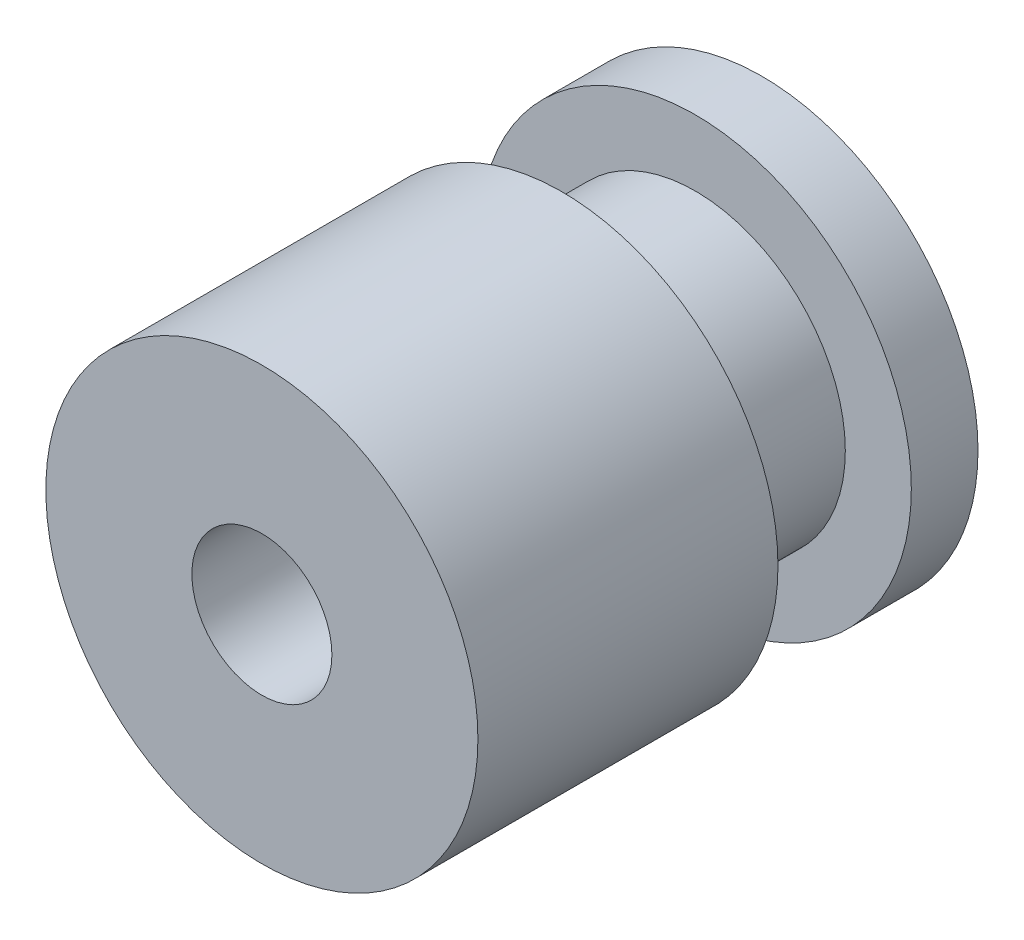
from build123d import *

# Parameters (mm, degrees)
SKETCH1_R               = 6.48
BOSS_EXTRUDE1_DEPTH     = 15
CUT_EXTRUDE3_DEPTH      = 2
CUT_EXTRUDE3_DEPTH_BACK = 2
CUT_EXTRUDE3_START      = -11
SKETCH8_OUTSIDE_W       = 19.696
SKETCH8_OUTSIDE_H       = 19.696
SKETCH8_OUTSIDE_R       = 4.5
M5_TAPPED_HOLE1_D       = 4.2
M5_TAPPED_HOLE1_DEPTH   = 7.4
M5_TAPPED_HOLE1_TIP     = 1.2618073


# Read off the part's stored shape, not the designer's step: Split2
with BuildPart() as part:
    # Sketch1 → Boss-Extrude1 (new body)
    with BuildSketch(Plane.XY):
        Circle(SKETCH1_R)
    extrude(amount=BOSS_EXTRUDE1_DEPTH)

    # Sketch8 outside → Cut-Extrude3 (cut, two sides: drawn at the far end of the back side and taken through both)
    with BuildSketch(Plane.XY.offset(15).offset(CUT_EXTRUDE3_START - CUT_EXTRUDE3_DEPTH_BACK)):
        Rectangle(SKETCH8_OUTSIDE_W, SKETCH8_OUTSIDE_H)
        Circle(SKETCH8_OUTSIDE_R, mode=Mode.SUBTRACT)
    extrude(amount=CUT_EXTRUDE3_DEPTH + CUT_EXTRUDE3_DEPTH_BACK, mode=Mode.SUBTRACT)

    # M5 Tapped Hole1
    with Locations(Plane.XY.offset(15)):
        with Locations((0, 0)):
            Hole(M5_TAPPED_HOLE1_D / 2, depth=M5_TAPPED_HOLE1_DEPTH)
            with Locations((0, 0, -(M5_TAPPED_HOLE1_DEPTH + M5_TAPPED_HOLE1_TIP / 2))):  # 118° drill point
                Cone(0, M5_TAPPED_HOLE1_D / 2, M5_TAPPED_HOLE1_TIP, mode=Mode.SUBTRACT)


with BuildPart() as body_2:
    # Split2: the piece on the far side of the plane
    add(part.part)
    split(bisect_by=Plane.XY.offset(2), keep=Keep.BOTTOM)


with BuildPart() as part_1:
    add(part.part)

    # Split2
    split(bisect_by=Plane.XY.offset(2), keep=Keep.TOP)


solid = Compound([body_2.part, part_1.part])
